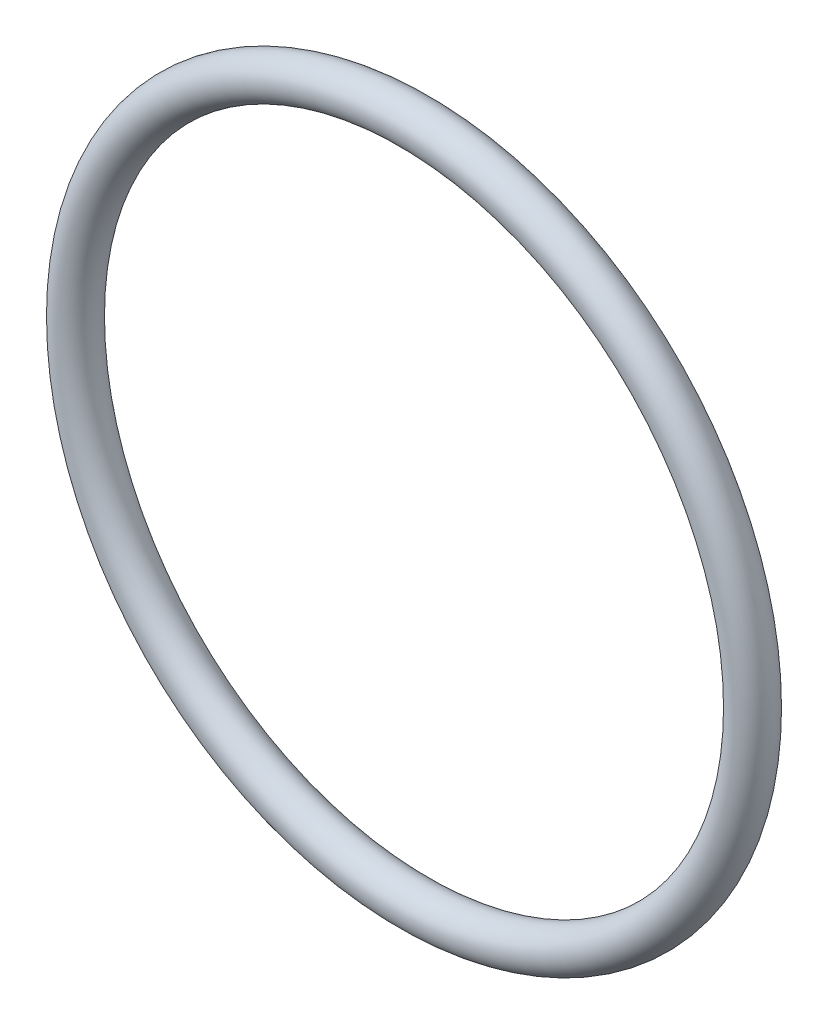
from build123d import *

# Parameters (mm, degrees)
SKETCH1_R = 1


with BuildPart() as part:
    # Sketch1 → Revolve1 (revolve)
    with BuildSketch(Plane(origin=(0, 0, 0), x_dir=(0, 0, -1), z_dir=(1, 0, 0))):
        with Locations((1.35878553, 48.170155039)):
            Circle(SKETCH1_R)
    revolve(axis=Axis((0, 31.670155039, 11.601937984), (0, 0, -1)))


solid = part.part
